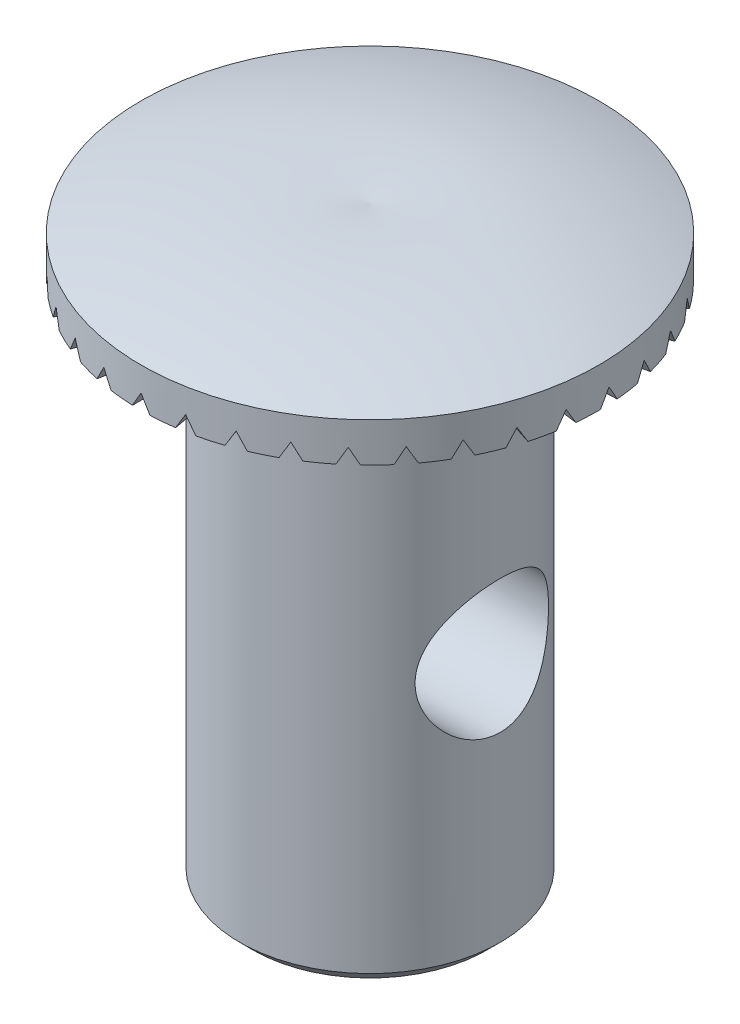
from build123d import *
from build123d.topology import SkipClean

# Parameters (mm, degrees)
CORTE_EXTRUS_O1_REACH            = 58.908
CORTE_EXTRUS_O1_END_RADIUS       = 9.95
PADR_OCIRCULAR1_COUNT            = 35
FURO_ROSCADO_DE_M81_D            = 6.8
FURO_ROSCADO_DE_M81_DEPTH        = 14
FURO_ROSCADO_DE_M81_CSINK_D      = 8.05
FURO_ROSCADO_DE_M81_CSINK_ANGLE  = 90
FURO_ROSCADO_DE_M81_TIP          = 2.042926105
FURO_ROSCADO_DE_M121_D           = 10.2
FURO_ROSCADO_DE_M121_DEPTH       = 72.75
FURO_ROSCADO_DE_M121_CSINK_D     = 12.05
FURO_ROSCADO_DE_M121_CSINK_ANGLE = 90
FURO_ROSCADO_DE_M121_TIP         = 3.064389157
CHANFRO1_SIZE                    = 1


with BuildPart() as part:
    # Esboço1 → Revolução1 (revolve)
    with BuildSketch(Plane.XY):
        with BuildLine():
            Line((9.95, 0), (17.5, 0))
            Line((17.5, 0), (17.5, 3))
            ThreePointArc((17.5, 3), (8.86145448, 4.975226699), (0, 5))
            Line((0, 5), (0, 0))
            Line((0, 0), (0, -40))
            Line((0, -40), (9.95, -40))
            Line((9.95, -40), (9.95, 0))
        make_face()
    revolve(axis=Axis((0, -40, 0), (0, 1, 0)))

    # Corte-extrusão1: up to this cylinder (the profile starts outside it)
    corte_extrus_o1_end = Plane(origin=(0, 0, 0), z_dir=(0, -1, 0)) * Cylinder(CORTE_EXTRUS_O1_END_RADIUS, 138.716, mode=Mode.PRIVATE)
    # Esboço2 → Corte-extrusão1 (cut, up to the surface)
    with BuildSketch(Plane.XY.offset(19), mode=Mode.PRIVATE) as corte_extrus_o1_sk1:
        Polygon((0, 1.154700538), (-1, -0.577350269), (1, -0.577350269), align=None)
    corte_extrus_o1_tool1 = extrude(corte_extrus_o1_sk1.sketch, amount=-CORTE_EXTRUS_O1_REACH, mode=Mode.PRIVATE) - corte_extrus_o1_end
    corte_extrus_o1 = corte_extrus_o1_tool1.solids().sort_by_distance((0, 0, 19))[0]
    add(corte_extrus_o1, mode=Mode.SUBTRACT)

    # PadrãoCircular1: Corte-extrusão1 ×35 about axis
    with SkipClean():  # the faces are left unmerged after this step: merging them gives an invalid solid
        padr_ocircular1_axis = Axis((0, 0, 0), (0, -1, 0))
        for i in range(1, PADR_OCIRCULAR1_COUNT):
            add(corte_extrus_o1.rotate(padr_ocircular1_axis, i * 360 / PADR_OCIRCULAR1_COUNT), mode=Mode.SUBTRACT)
    add(part.part.scale(1), mode=Mode.REPLACE)  # the faces are merged on a copy

    # Furo roscado de M81
    with Locations(Plane(origin=(0, -40, 0), x_dir=(-1, 0, 0), z_dir=(0, -1, 0))):
        with Locations((0, 0)):
            CounterSinkHole(FURO_ROSCADO_DE_M81_D / 2, FURO_ROSCADO_DE_M81_CSINK_D / 2, depth=FURO_ROSCADO_DE_M81_DEPTH, counter_sink_angle=FURO_ROSCADO_DE_M81_CSINK_ANGLE)
            with Locations((0, 0, -(FURO_ROSCADO_DE_M81_DEPTH + FURO_ROSCADO_DE_M81_TIP / 2))):  # 118° drill point
                Cone(0, FURO_ROSCADO_DE_M81_D / 2, FURO_ROSCADO_DE_M81_TIP, mode=Mode.SUBTRACT)

    # Furo roscado de M121
    with Locations(Plane(origin=(19, 0, 0), x_dir=(0, 0, 1), z_dir=(1, 0, 0))):
        with Locations((0, 20)):
            CounterSinkHole(FURO_ROSCADO_DE_M121_D / 2, FURO_ROSCADO_DE_M121_CSINK_D / 2, depth=FURO_ROSCADO_DE_M121_DEPTH, counter_sink_angle=FURO_ROSCADO_DE_M121_CSINK_ANGLE)
            with Locations((0, 0, -(FURO_ROSCADO_DE_M121_DEPTH + FURO_ROSCADO_DE_M121_TIP / 2))):  # 118° drill point
                Cone(0, FURO_ROSCADO_DE_M121_D / 2, FURO_ROSCADO_DE_M121_TIP, mode=Mode.SUBTRACT)

    # Chanfro1
    chanfro1_edges = [part.edges().sort_by_distance(p)[0] for p in [
        (-9.95, -40, 0),
    ]]
    chamfer(chanfro1_edges, length=CHANFRO1_SIZE)


solid = part.part
